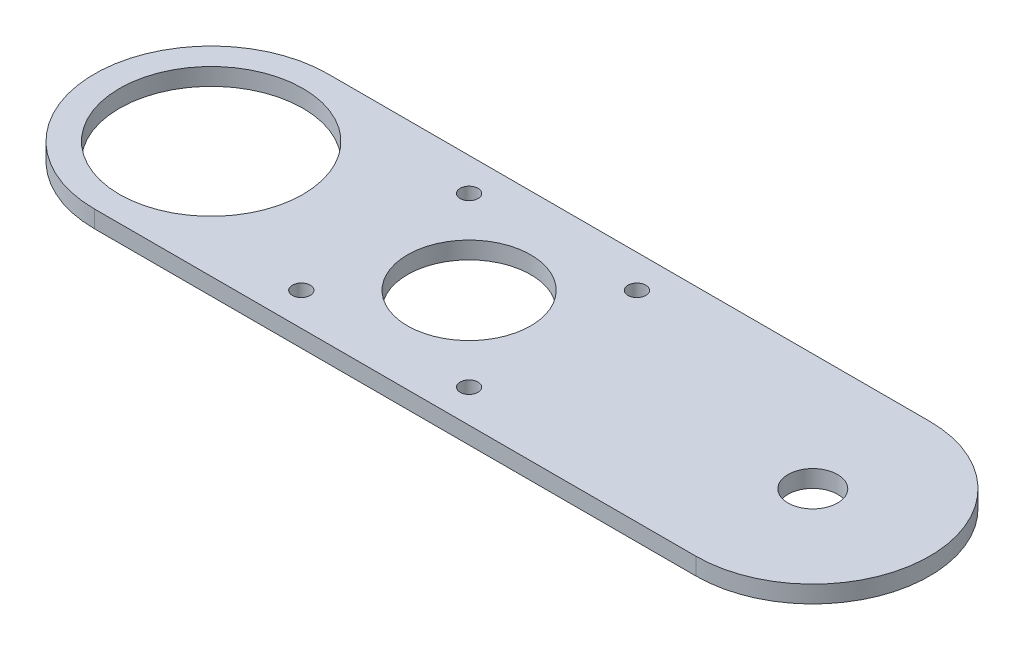
from build123d import *

# Parameters (mm, degrees)
SKETCH1_R           = 16.9545
SKETCH1_R_2         = 4.572
SKETCH1_R_3         = 11.380999971
SKETCH1_R_4         = 1.651
BOSS_EXTRUDE1_DEPTH = 3.175


with BuildPart() as part:
    # Sketch1 → Boss-Extrude1 (new body)
    with BuildSketch(Plane(origin=(0, 0, 0), x_dir=(1, 0, 0), z_dir=(0, 1, 0))):
        with BuildLine():
            Line((0, 21.59), (111.1504, 21.59))
            ThreePointArc((111.1504, 21.59), (132.7404, 0), (111.1504, -21.59))
            Line((111.1504, -21.59), (0, -21.59))
            ThreePointArc((0, -21.59), (-21.59, 0), (0, 21.59))
        make_face()
        Circle(SKETCH1_R, mode=Mode.SUBTRACT)
        with Locations((111.1504, 0)):
            Circle(SKETCH1_R_2, mode=Mode.SUBTRACT)
        with Locations((47.6504, 0)):
            Circle(SKETCH1_R_3, mode=Mode.SUBTRACT)
        with Locations((32.1504, -15.5)):
            Circle(SKETCH1_R_4, mode=Mode.SUBTRACT)
        with Locations((32.1504, 15.5)):
            Circle(SKETCH1_R_4, mode=Mode.SUBTRACT)
        with Locations((63.1504, 15.5)):
            Circle(SKETCH1_R_4, mode=Mode.SUBTRACT)
        with Locations((63.1504, -15.5)):
            Circle(SKETCH1_R_4, mode=Mode.SUBTRACT)
    extrude(amount=BOSS_EXTRUDE1_DEPTH)


solid = part.part
